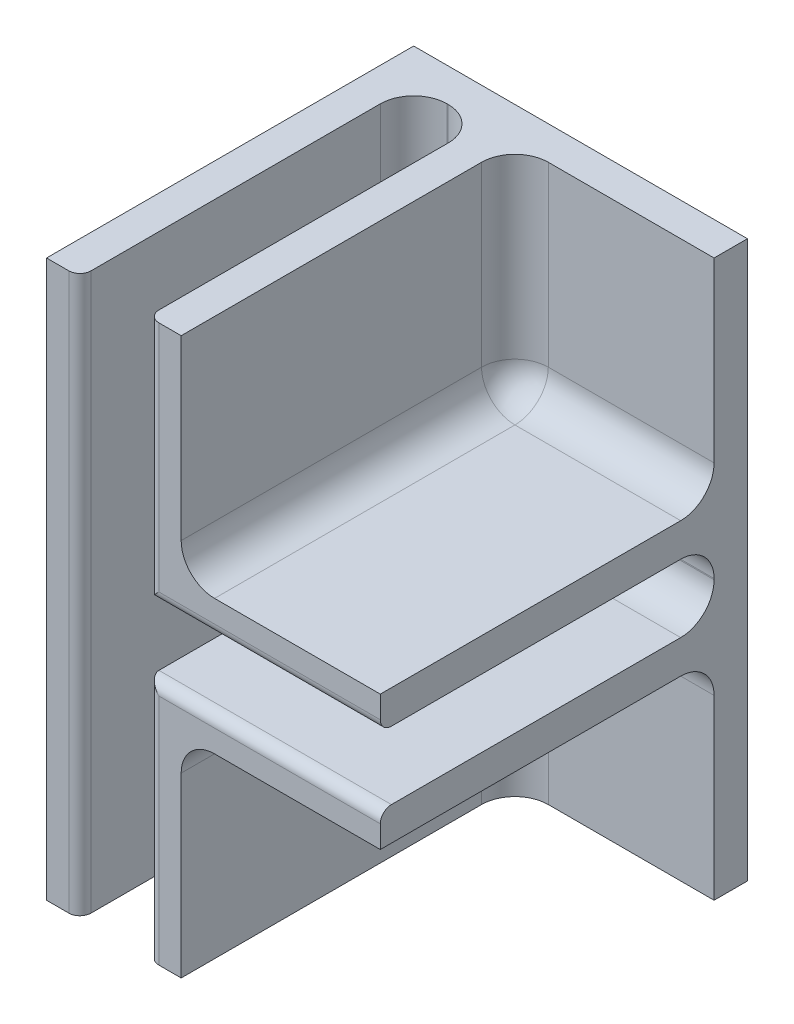
from build123d import *

# Parameters (mm, degrees)
SKETCH1_W           = 30
SKETCH1_H           = 50
BOSS_EXTRUDE1_DEPTH = 3
SKETCH2_W           = 3
SKETCH2_H           = 50
BOSS_EXTRUDE2_DEPTH = 30
FILLET2_R           = 3
FILLET3_R           = 1


with BuildPart() as part:
    # Sketch1 → Boss-Extrude1 (new body)
    with BuildSketch(Plane.XY):
        with Locations((15, 25)):
            Rectangle(SKETCH1_W, SKETCH1_H)
    extrude(amount=BOSS_EXTRUDE1_DEPTH)

    # Sketch2 → Boss-Extrude2 (add)
    with BuildSketch(Plane.XY.offset(3)):
        Polygon((9.1, 50), (9.1, 28.05), (30, 28.05), (30, 31.05), (12.1, 31.05), (12.1, 50), align=None)
        with Locations((1.5, 25)):
            Rectangle(SKETCH2_W, SKETCH2_H)
        Polygon((9.1, 0), (9.1, 21.95), (30, 21.95), (30, 18.95), (12.1, 18.95), (12.1, 0), align=None)
    extrude(amount=BOSS_EXTRUDE2_DEPTH)

    # Fillet2
    fillet2_edges = [part.edges().sort_by_distance(p)[0] for p in [
        (12.1, 18.95, 18),
        (21.05, 18.95, 3),
        (12.1, 9.475, 3),
        (12.1, 31.05, 18),
        (21.05, 31.05, 3),
        (12.1, 40.525, 3),
        (19.55, 21.95, 3),
        (19.55, 28.05, 3),
        (9.1, 39.025, 3),
        (9.1, 10.975, 3),
        (3, 25, 3),
    ]]
    fillet(fillet2_edges, radius=FILLET2_R)

    # Fillet3
    fillet3_edges = [part.edges().sort_by_distance(p)[0] for p in [
        (19.55, 21.95, 33),
        (19.55, 28.05, 33),
        (9.1, 39.025, 33),
        (9.1, 10.975, 33),
        (3, 25, 33),
    ]]
    fillet(fillet3_edges, radius=FILLET3_R)


solid = part.part
